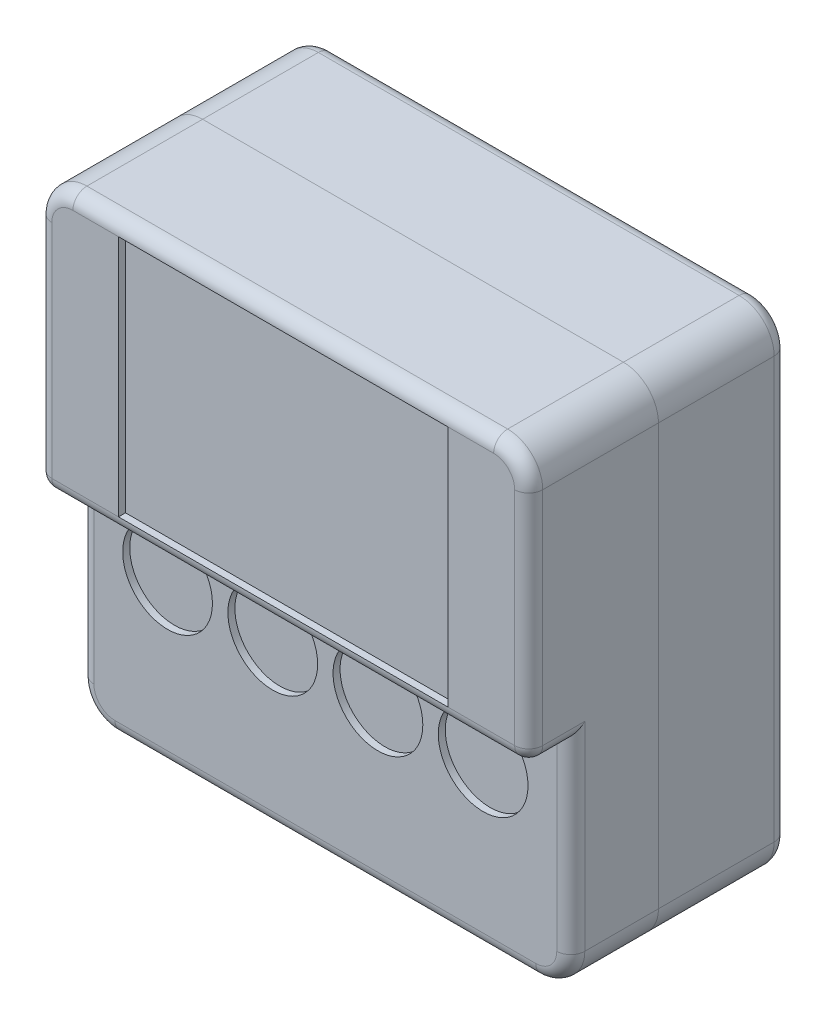
from build123d import *

# Parameters (mm, degrees)
SKETCH_1_W                     = 70
SKETCH_1_H                     = 70
EXTRUDE_2_DEPTH                = 31
SKETCH_4_W                     = 70
SKETCH_4_H                     = 38.6
EXTRUDE_3_DEPTH                = 6
SKETCH_3_R                     = 6.4
CUT_EXTRUDE_2_DEPTH            = 1
SPLIT_BODIES_1_SURFACE_1_BACK  = 106.683
SPLIT_BODIES_1_SURFACE_1_DEPTH = 213.366
SPLIT_BODIES_1_SURFACE_2_BACK  = 106.683
SPLIT_BODIES_1_SURFACE_2_DEPTH = 213.366
WRAP_START                     = 5
WRAP_1_OUTLINE_W               = 47
WRAP_1_OUTLINE_H               = 34.6
WRAP_1_DEPTH                   = 1
FILLET_1_R                     = 5
FILLET_2_R                     = 2
FILLET_3_R                     = 5
FILLET_4_R                     = 5
FILLET_5_R                     = 5
FILLET_START                   = -30
FILLET_6_DEPTH                 = 65
FILLET_6_2_ANGLE               = 90
FILLET_7_R                     = 2
FILLET_8_R                     = 2
FILLET_9_R                     = 5
FILLET_10_R                    = 5
FILLET_11_R                    = 5
FILLET_12_R                    = 5
FILLET_13_R                    = 2


with BuildPart() as part:
    # 草图1 → 凸台-拉伸2 (new body)
    with BuildSketch(Plane.XY):
        Rectangle(SKETCH_1_W, SKETCH_1_H)
    extrude(amount=-EXTRUDE_2_DEPTH)

    # 草图4 → 凸台-拉伸3 (add)
    with BuildSketch(Plane.XY):
        with Locations((0, 15.7)):
            Rectangle(SKETCH_4_W, SKETCH_4_H)
    extrude(amount=EXTRUDE_3_DEPTH)

    # 草图3 → 切除-拉伸2 (cut)
    with BuildSketch(Plane.XY):
        with Locations((-22.5, -11.6)):
            Circle(SKETCH_3_R)
        with Locations((-7.5, -11.6)):
            Circle(SKETCH_3_R)
        with Locations((7.5, -11.6)):
            Circle(SKETCH_3_R)
        with Locations((22.5, -11.6)):
            Circle(SKETCH_3_R)
    extrude(amount=-CUT_EXTRUDE_2_DEPTH, mode=Mode.SUBTRACT)


with BuildPart() as body_2:
    # Split Bodies 1: the piece behind the surface
    add(part.part)
    # Split Bodies 1 surface: a surface, the sketch's curves swept straight by 213.366 mm
    with BuildLine(Plane.ZY.offset(35).offset(-SPLIT_BODIES_1_SURFACE_1_BACK), mode=Mode.PRIVATE) as split_bodies_1_surface_1_path:
        Line((-12.5, 35), (-12.5, -35))
    split_bodies_1_surface_1 = Shell.extrude(split_bodies_1_surface_1_path.wire(), (-1 * SPLIT_BODIES_1_SURFACE_1_DEPTH, 0 * SPLIT_BODIES_1_SURFACE_1_DEPTH, 0 * SPLIT_BODIES_1_SURFACE_1_DEPTH))
    split(bisect_by=split_bodies_1_surface_1, keep=Keep.BOTTOM)

    # 圆角9
    fillet_9_edges = [body_2.edges().sort_by_distance(p)[0] for p in [
        (-35, 35, -21.75),
    ]]
    fillet(fillet_9_edges, radius=FILLET_9_R)

    # 圆角10
    fillet_10_edges = [body_2.edges().sort_by_distance(p)[0] for p in [
        (-35, -35, -21.75),
    ]]
    fillet(fillet_10_edges, radius=FILLET_10_R)

    # 圆角11
    fillet_11_edges = [body_2.edges().sort_by_distance(p)[0] for p in [
        (35, -35, -21.75),
    ]]
    fillet(fillet_11_edges, radius=FILLET_11_R)

    # 圆角12
    fillet_12_edges = [body_2.edges().sort_by_distance(p)[0] for p in [
        (35, 35, -21.75),
    ]]
    fillet(fillet_12_edges, radius=FILLET_12_R)

    # 圆角13
    fillet_13_edges = [body_2.edges().sort_by_distance(p)[0] for p in [
        (-35, 0, -31),
        (-33.535533906, 33.535533906, -31),
        (0, -35, -31),
        (-33.535533906, -33.535533906, -31),
        (35, 0, -31),
        (33.535533906, -33.535533906, -31),
        (0, 35, -31),
        (33.535533906, 33.535533906, -31),
    ]]
    fillet(fillet_13_edges, radius=FILLET_13_R)


with BuildPart() as part_1:
    add(part.part)

    # Split Bodies 1: split by a surface, the side it looks to stays
    # Split Bodies 1 surface: a surface, the sketch's curves swept straight by 213.366 mm
    with BuildLine(Plane.ZY.offset(35).offset(-SPLIT_BODIES_1_SURFACE_2_BACK), mode=Mode.PRIVATE) as split_bodies_1_surface_2_path:
        Line((-12.5, 35), (-12.5, -35))
    split_bodies_1_surface_2 = Shell.extrude(split_bodies_1_surface_2_path.wire(), (-1 * SPLIT_BODIES_1_SURFACE_2_DEPTH, 0 * SPLIT_BODIES_1_SURFACE_2_DEPTH, 0 * SPLIT_BODIES_1_SURFACE_2_DEPTH))
    split(bisect_by=split_bodies_1_surface_2, keep=Keep.TOP)

    # 包覆1: read off the stored shape, not the designer's step
    # 包覆1 outline → 包覆1 (cut)
    with BuildSketch(Plane.XY.offset(WRAP_START)):
        with Locations((0, 15.7)):
            Rectangle(WRAP_1_OUTLINE_W, WRAP_1_OUTLINE_H)
    extrude(amount=WRAP_1_DEPTH, mode=Mode.SUBTRACT)

    # 圆角1
    fillet_1_edges = [part_1.edges().sort_by_distance(p)[0] for p in [
        (-35, 35, -3.25),
    ]]
    fillet(fillet_1_edges, radius=FILLET_1_R)

    # 圆角2
    fillet_2_edges = [part_1.edges().sort_by_distance(p)[0] for p in [
        (2.5, 35, 6),
        (-35, 13.2, 6),
        (-33.535533906, 33.535533906, 6),
    ]]
    fillet(fillet_2_edges, radius=FILLET_2_R - 0.0001)  # a hair under: the kernel refuses the full size

    # 圆角3
    # the kernel refuses this fillet: 5 mm, written as the material it takes off along each edge
    with BuildSketch(Plane(origin=(35, 35, -25), x_dir=(-1, 0, 0), z_dir=(0, 0, 1))) as fillet_3_piece_1:
        with BuildLine():
            CenterArc((FILLET_3_R, FILLET_3_R), FILLET_3_R, 180, 90)
            Line((0, FILLET_3_R), (0, 0))
            Line((0, 0), (FILLET_3_R, 0))
        make_face()
    extrude(amount=41.5001, mode=Mode.SUBTRACT)

    # 圆角4
    fillet_4_edges = [part_1.edges().sort_by_distance(p)[0] for p in [
        (-35, -35, -6.25),
    ]]
    fillet(fillet_4_edges, radius=FILLET_4_R)

    # 圆角5
    fillet_5_edges = [part_1.edges().sort_by_distance(p)[0] for p in [
        (35, -35, -6.25),
    ]]
    fillet(fillet_5_edges, radius=FILLET_5_R)

    # 圆角6: read off the stored shape, not the designer's step
    # 圆角6 outline → 圆角6 (cut)
    with BuildSketch(Plane(origin=(0, 0, 0), x_dir=(1, 0, 0), z_dir=(0, 1, 0)).offset(FILLET_START)):
        with BuildLine():
            Line((35, -6), (35, -4))
            ThreePointArc((35, -4), (34.414213562, -5.414213562), (33, -6))
            Line((33, -6), (35, -6))
        make_face()
    extrude(amount=FILLET_6_DEPTH, mode=Mode.SUBTRACT)

    # Fillet 6 2 outline → Fillet 6 2 (revolve, cut)
    with BuildSketch(Plane(origin=(30, 30, 0), x_dir=(1, 0, 0), z_dir=(0, -1, 0))):
        with BuildLine():
            ThreePointArc((3, 6), (4.414213562, 5.414213562), (5, 4))
            Line((5, 4), (5, 6))
            Line((5, 6), (3, 6))
        make_face()
    revolve(axis=Axis((30, 30, 0), (0, 0, 1)), revolution_arc=FILLET_6_2_ANGLE, mode=Mode.SUBTRACT)

    # 圆角7
    fillet_7_edges = [part_1.edges().sort_by_distance(p)[0] for p in [
        (-35, -3.6, 2.00005),
        (-5e-05, -3.6, 6),
        (-34.414242852, -3.6, 5.414242852),
        (35, -3.6, 2),
        (34.414213562, -3.6, 5.414213562),
    ]]
    fillet(fillet_7_edges, radius=FILLET_7_R - 0.0001)  # a hair under: the kernel refuses the full size

    # 圆角8
    fillet_8_edges = [part_1.edges().sort_by_distance(p)[0] for p in [
        (-35, -15.80005, 0),
        (0, -35, 0),
        (-33.535533906, -33.535533906, 0),
        (35, -15.80005, 0),
        (33.535533906, -33.535533906, 0),
    ]]
    fillet(fillet_8_edges, radius=FILLET_8_R - 0.0001)  # a hair under: the kernel refuses the full size


solid = Compound([body_2.part, part_1.part])
